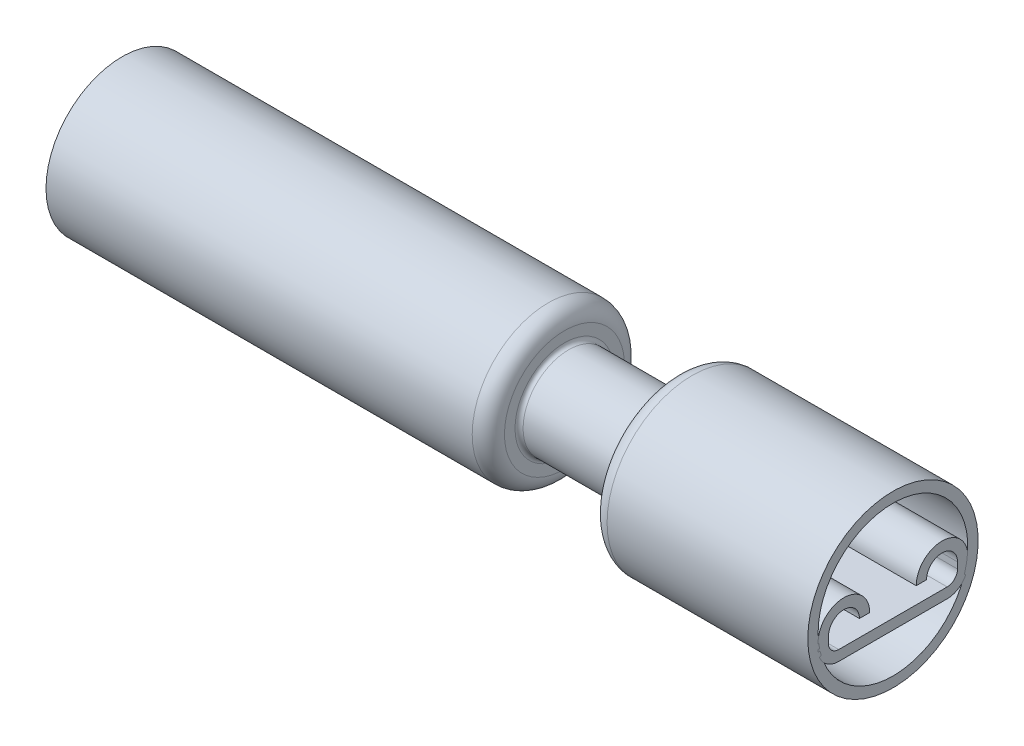
from build123d import *

# Parameters (mm, degrees)
BOSS_EXTRUDE1_START = -1.7272
BOSS_EXTRUDE1_DEPTH = 1.3208
FILLET1_R           = 1.016
SHELL1_T            = -0.508
SKETCH4_R           = 1.7272
SKETCH4_R_2         = 1.2192
BOSS_EXTRUDE2_DEPTH = 6.50875
SKETCH5_R           = 1.2192
CUT_EXTRUDE1_DEPTH  = 18.157940885
BOSS_EXTRUDE3_DEPTH = 7.9375
FILLET2_R           = 0.79375
FILLET3_R           = 0.1984375


with BuildPart() as part:
    # Sketch3 → Boss-Extrude1 (new body)
    with BuildSketch(Plane(origin=(0, 0, 0), x_dir=(1, 0, 0), z_dir=(0, 1, 0)).offset(BOSS_EXTRUDE1_START)):
        with BuildLine():
            Line((18.9611, -3.683), (18.9611, 3.683))
            Line((18.9611, 3.683), (11.0236, 3.683))
            ThreePointArc((11.0236, 3.683), (10.300267506, 3.508633523), (9.735832572, 3.023837925))
            Line((9.735832572, 3.023837925), (8.8011, 1.7272))
            Line((8.8011, 1.7272), (8.8011, -1.7272))
            Line((8.8011, -1.7272), (9.735832572, -3.023837925))
            ThreePointArc((9.735832572, -3.023837925), (10.300267506, -3.508633523), (11.0236, -3.683))
            Line((11.0236, -3.683), (18.9611, -3.683))
        make_face()
    extrude(amount=BOSS_EXTRUDE1_DEPTH)

    # Fillet1
    # the kernel refuses this fillet: 1.016 mm, written as the material it takes off along each edge
    with BuildSketch(Plane(origin=(11.0236, -1.7272, 3.683), x_dir=(0, 1, 0), z_dir=(1, 0, 0)), Plane(origin=(21.5011, -1.7272, -3.683), x_dir=(0, 1, 0), z_dir=(-1, 0, 0))) as fillet1_piece_1:
        with BuildLine():
            CenterArc((FILLET1_R, -FILLET1_R), FILLET1_R, 90, 90)
            Line((0, -FILLET1_R), (0, 0))
            Line((0, 0), (FILLET1_R, 0))
        make_face()
    extrude(amount=10.4775, mode=Mode.SUBTRACT)
    with BuildSketch(Plane(origin=(7.31575932, -1.7272, -0.333227884), x_dir=(0, 1, 0), z_dir=(0.5847797951356621, 0, 0.8111920803367678)), Plane(origin=(9.735832572, -1.7272, -3.023837925), x_dir=(0, 1, 0), z_dir=(-0.5847797951356621, 0, 0.8111920803367678))) as fillet1_piece_2:
        with BuildLine():
            CenterArc((FILLET1_R, -FILLET1_R), FILLET1_R, 90, 90)
            Line((0, -FILLET1_R), (0, 0))
            Line((0, 0), (FILLET1_R, 0))
        make_face()
    extrude(amount=4.138435138, mode=Mode.SUBTRACT)
    with BuildSketch(Plane(origin=(11.0236, -1.7272, 2.0955), x_dir=(-0.8111920803367688, 0, 0.5847797951356606), z_dir=(-0.5847797951356606, 0, -0.8111920803367688))) as fillet1_piece_3:
        with BuildLine():
            CenterArc((1.5875 - FILLET1_R, FILLET1_R), FILLET1_R, 270, 90)
            Line((1.5875 - FILLET1_R, 0), (1.5875, 0))
            Line((1.5875, 0), (1.5875, FILLET1_R))
        make_face()
    revolve(axis=Axis((11.0236, -1.7272, 2.0955), (0, 1, 0)), revolution_arc=54.212564929, mode=Mode.SUBTRACT)
    with BuildSketch(Plane(origin=(11.0236, -1.7272, -2.0955), x_dir=(0, 0, -1), z_dir=(1, 0, 0))) as fillet1_piece_4:
        with BuildLine():
            CenterArc((1.5875 - FILLET1_R, FILLET1_R), FILLET1_R, 270, 90)
            Line((1.5875 - FILLET1_R, 0), (1.5875, 0))
            Line((1.5875, 0), (1.5875, FILLET1_R))
        make_face()
    revolve(axis=Axis((11.0236, -1.7272, -2.0955), (0, 1, 0)), revolution_arc=54.212564929, mode=Mode.SUBTRACT)

    # Shell1
    shell1_openings = [part.faces().sort_by_distance(p)[0] for p in [
        (14.067725461, -0.4064, 0),
        (18.9611, -1.046119025, 0),
        (8.8011, -0.98049065, 0),
    ]]
    offset(amount=SHELL1_T, openings=shell1_openings, kind=Kind.INTERSECTION)

    # Sketch4 → Boss-Extrude2 (add)
    with BuildSketch(Plane.ZY.offset(-8.8011)):
        with Locations(Location((0, 0, 0), (0, 0, 193.608960631))):
            Circle(SKETCH4_R)
        with Locations(Location((0, 0, 0), (0, 0, 199.471220634))):
            Circle(SKETCH4_R_2, mode=Mode.SUBTRACT)
    extrude(amount=BOSS_EXTRUDE2_DEPTH)

    # Sketch5 → Cut-Extrude1 (cut, through all)
    with BuildSketch(Plane.ZY.offset(-2.29235)):
        with Locations(Location((0, 0, 0), (0, 0, 199.471220634))):
            Circle(SKETCH5_R)
    extrude(amount=-CUT_EXTRUDE1_DEPTH, mode=Mode.SUBTRACT)

    # Sketch6 → Boss-Extrude3 (add)
    with BuildSketch(Plane(origin=(18.9611, 0, 0), x_dir=(0, 0, -1), z_dir=(1, 0, 0))):
        with BuildLine():
            Line((3.683, -0.7112), (3.683, -0.4064))
            Line((3.683, -0.4064), (3.175, -0.4064))
            Line((3.175, -0.4064), (3.175, -0.7112))
            ThreePointArc((3.175, -0.7112), (3.026210245, -1.070410245), (2.667, -1.2192))
            Line((2.667, -1.2192), (-2.667, -1.2192))
            ThreePointArc((-2.667, -1.2192), (-3.026210245, -1.070410245), (-3.175, -0.7112))
            Line((-3.175, -0.7112), (-3.175, -0.4064))
            Line((-3.175, -0.4064), (-3.683, -0.4064))
            Line((-3.683, -0.4064), (-3.683, -0.7112))
            ThreePointArc((-3.683, -0.7112), (-3.38542049, -1.42962049), (-2.667, -1.7272))
            Line((-2.667, -1.7272), (2.667, -1.7272))
            ThreePointArc((2.667, -1.7272), (3.38542049, -1.42962049), (3.683, -0.7112))
        make_face()
        with BuildLine():
            Line((3.175, -0.4064), (3.683, -0.4064))
            ThreePointArc((3.683, -0.4064), (2.413, 0.8636), (1.143, -0.4064))
            Line((1.143, -0.4064), (1.651, -0.4064))
            ThreePointArc((1.651, -0.4064), (2.413, 0.3556), (3.175, -0.4064))
        make_face()
        with BuildLine():
            ThreePointArc((-1.143, -0.4064), (-2.413, 0.8636), (-3.683, -0.4064))
            Line((-3.683, -0.4064), (-3.175, -0.4064))
            ThreePointArc((-3.175, -0.4064), (-2.413, 0.3556), (-1.651, -0.4064))
            Line((-1.651, -0.4064), (-1.143, -0.4064))
        make_face()
    extrude(amount=-BOSS_EXTRUDE3_DEPTH)


with BuildPart() as body_2:
    # Sketch9 → Revolve1 (revolve)
    with BuildSketch(Plane.XY, mode=Mode.PRIVATE) as revolve1_sk:
        Polygon((-18.9611, 3.2385), (2.29235, 3.2385), (2.29235, 1.7272), (8.8011, 1.7272), (8.8011, 3.683), (18.9611, 3.683), (18.9611, 4.191), (8.2931, 4.191), (8.2931, 2.2352), (2.80035, 2.2352), (2.80035, 3.7465), (-18.9611, 3.7465), align=None)
    revolve(revolve1_sk.sketch.rotate(Axis((-18.9611, 0, 0), (1, 0, 0)), 90), axis=Axis((-18.9611, 0, 0), (1, 0, 0)))

    # Fillet2
    fillet2_edges = [body_2.edges().sort_by_distance(p)[0] for p in [
        (8.2931, 0, -4.191),
        (2.80035, 0, -3.7465),
    ]]
    fillet(fillet2_edges, radius=FILLET2_R)

    # Fillet3
    fillet3_edges = [body_2.edges().sort_by_distance(p)[0] for p in [
        (8.2931, 0, -2.2352),
        (2.80035, 0, -2.2352),
    ]]
    fillet(fillet3_edges, radius=FILLET3_R)


solid = Compound([part.part, body_2.part])
